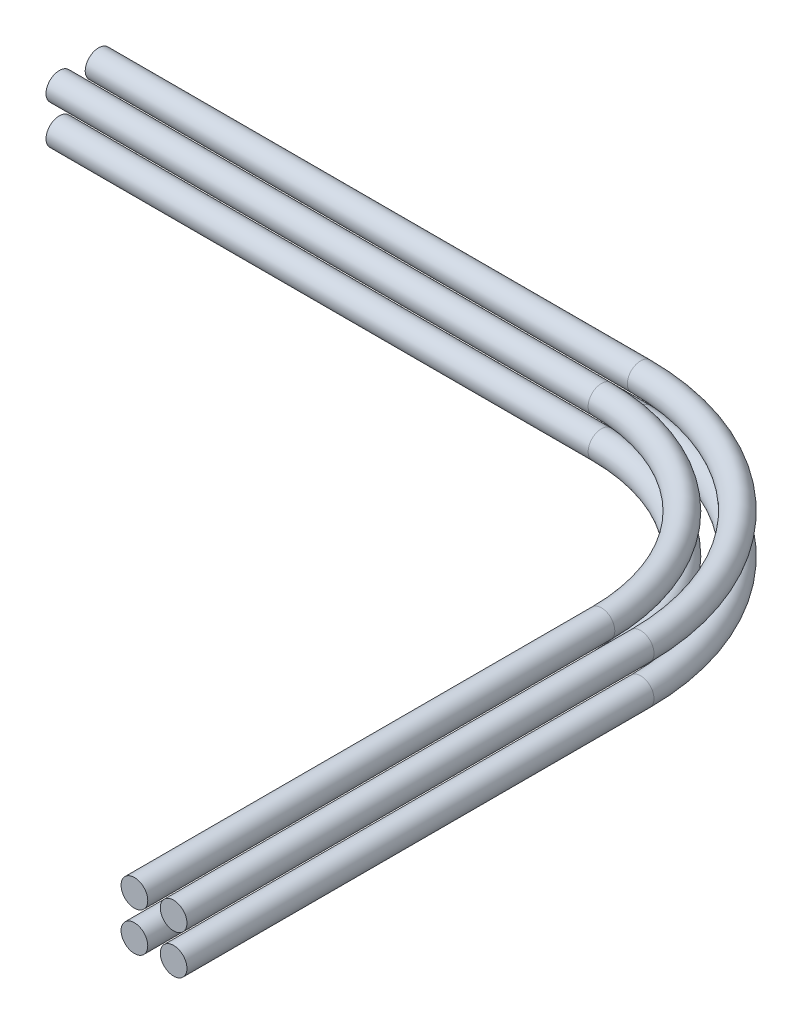
from build123d import *

# Parameters (mm, degrees)
SKETCH2_R       = 1.6
LPATTERN1_COUNT = 2
LPATTERN1_PITCH = 4.7


with BuildPart() as part:
    # Sweep1: sweep along a path in Sketch1
    with BuildLine(Plane(origin=(0, 0, 0), x_dir=(1, 0, 0), z_dir=(0, 1, 0))) as sweep1_path:
        Line((0, 0), (65, 0))
        ThreePointArc((65, 0), (84.798989873, -8.201010127), (93, -28))
        Line((93, -28), (93, -84))
    # Sketch2 → Sweep1 (sweep)
    with BuildSketch(Plane(origin=(0, 0, 0), x_dir=(0, 0, -1), z_dir=(1, 0, 0))):
        Circle(SKETCH2_R)
        with Locations((-4.7, 0)):
            Circle(SKETCH2_R)
    sweep1 = sweep(path=sweep1_path.line)


with BuildPart() as lpattern1_1:
    # LPattern1: Sweep1 ×2
    with Locations(*[(0, i * LPATTERN1_PITCH, 0) for i in range(1, LPATTERN1_COUNT)]):
        add(sweep1)


solid = Compound([part.part, lpattern1_1.part])
